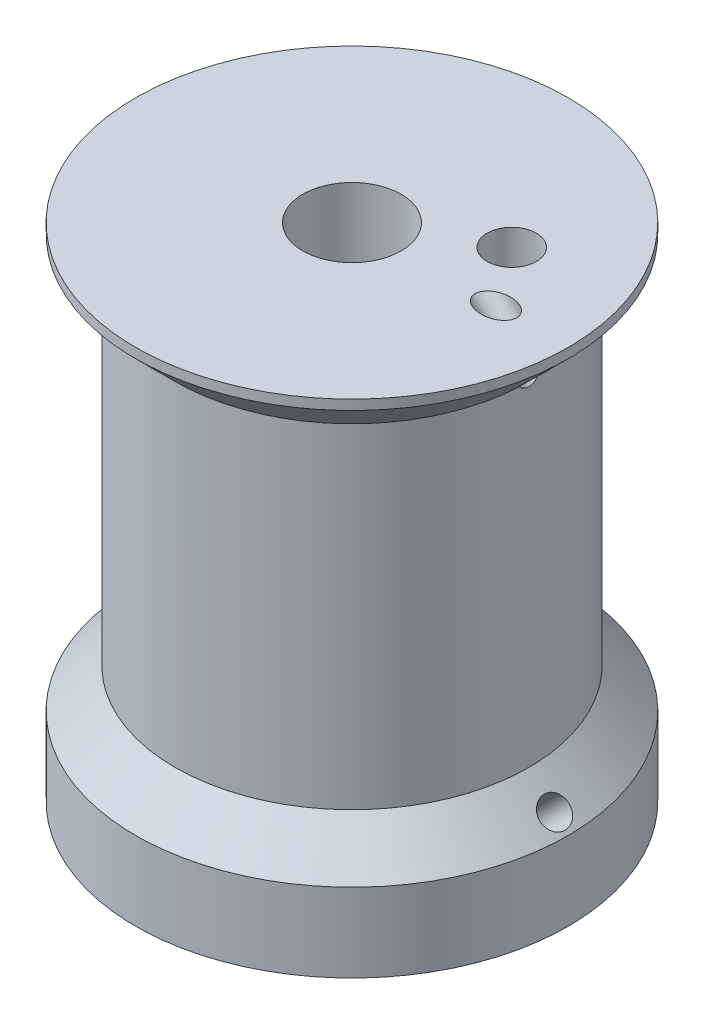
from build123d import *

# Parameters (mm, degrees)
SKETCH9_R          = 1.25
CUT_EXTRUDE2_DEPTH = 30.870554062
SKETCH13_W         = 1.25
SKETCH13_H         = 11


with BuildPart() as part:
    # Sketch11 → Revolve1 (revolve)
    with BuildSketch(Plane.XY):
        Polygon((2.5, 25.5), (11, 25.5), (11, 25), (9, 23), (9, 6), (11, 4), (11, 0), (2.5, 0), align=None)
    revolve(axis=Axis((0, 0, 0), (0, 1, 0)))

    # Sketch9 → Cut-Extrude2 (cut, through all)
    with BuildSketch(Plane.XZ):
        with Locations((5.152851153, -2.975)):
            Circle(SKETCH9_R)
    extrude(amount=-CUT_EXTRUDE2_DEPTH, mode=Mode.SUBTRACT)

    # Sketch10 → Cut-Revolve1 (revolve, cut)
    with BuildSketch(Plane.XY):
        Polygon((5.095658377, -0.530330086), (10.312994231, 4.687005769), (9.782664146, 5.217335854), (4.565328291, 0), align=None)
    revolve(axis=Axis((10.312994231, 4.687005769, 0), (-0.7071067811865475, -0.7071067811865476, 0)), mode=Mode.SUBTRACT)

    # Sketch10<3> → Cut-Revolve2 (revolve, cut)
    with BuildSketch(Plane.XY):
        Polygon((9.885405854, 21.876978712), (10.41573594, 22.407308798), (6.792714652, 26.030330086), (6.262384566, 25.5), align=None)
    revolve(axis=Axis((10.41573594, 22.407308798, 0), (-0.7071067811865477, 0.7071067811865474, 0)), mode=Mode.SUBTRACT)

    # Sketch13 → M3x0.5 Tapped Hole1 (revolve, cut)
    with BuildSketch(Plane(origin=(0, 2, 0), x_dir=(0, 0, -1), z_dir=(0, 1, 0))):
        with Locations((0.625, 5.5)):
            Rectangle(SKETCH13_W, SKETCH13_H)
    revolve(axis=Axis((6.35, 2, 0), (-1, 0, 0)), mode=Mode.SUBTRACT)


solid = part.part
